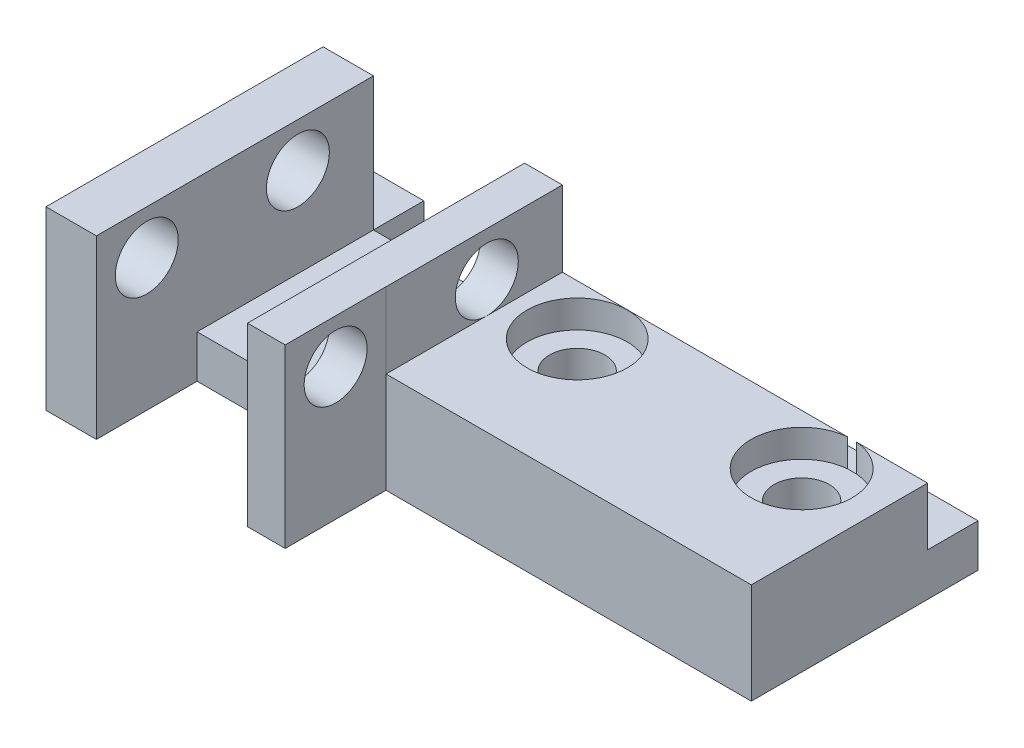
from build123d import *

# Parameters (mm, degrees)
SKETCH1_R           = 0.8
BOSS_EXTRUDE1_DEPTH = 3
SKETCH3_W           = 24
SKETCH3_H           = 4
BOSS_EXTRUDE2_DEPTH = 4
SKETCH6_W           = 24
SKETCH6_H           = 4
BOSS_EXTRUDE4_DEPTH = 3
CUT_EXTRUDE1_DEPTH  = 2.3
SKETCH9_W           = 2
SKETCH9_H           = 7
SKETCH9_W_2         = 1.5
BOSS_EXTRUDE5_DEPTH = 3
SKETCH11_W          = 2
SKETCH11_H          = 7
SKETCH11_W_2        = 1.497470588
BOSS_EXTRUDE6_DEPTH = 4
SKETCH10_R          = 1.25
CUT_EXTRUDE2_DEPTH  = 18.557049866
SKETCH12_W          = 2
SKETCH12_H          = 1.704314434
SKETCH12_W_2        = 16
BOSS_EXTRUDE7_DEPTH = 2
SKETCH13_R          = 1.1
CUT_EXTRUDE3_DEPTH  = 10
SKETCH15_R          = 2.007738278
SKETCH15_R_2        = 1.991162831
CUT_EXTRUDE4_DEPTH  = 1.1


with BuildPart() as part:
    # Sketch1 → Boss-Extrude1 (new body)
    with BuildSketch(Plane(origin=(0, 0, 0), x_dir=(1, 0, 0), z_dir=(0, 1, 0))):
        with Locations((-4, 2)):
            Circle(SKETCH1_R)
    extrude(amount=-BOSS_EXTRUDE1_DEPTH)

    # Sketch3 → Boss-Extrude2 (add)
    with BuildSketch(Plane(origin=(0, 0, 0), x_dir=(1, 0, 0), z_dir=(0, 1, 0))):
        with Locations((-13, 2)):
            Rectangle(SKETCH3_W, SKETCH3_H)
    extrude(amount=BOSS_EXTRUDE2_DEPTH)

    # Sketch6 → Boss-Extrude4 (add)
    with BuildSketch(Plane.XY):
        with Locations((-13, 2)):
            Rectangle(SKETCH6_W, SKETCH6_H)
    extrude(amount=BOSS_EXTRUDE4_DEPTH)

    # Sketch7 → Cut-Extrude1 (cut)
    with BuildSketch(Plane(origin=(0, 4, 0), x_dir=(1, 0, 0), z_dir=(0, 1, 0))):
        Polygon((-23, 0.5), (-23, -3), (-17, -3), (-17, 4), (-23, 4), align=None)
    extrude(amount=-CUT_EXTRUDE1_DEPTH, mode=Mode.SUBTRACT)

    # Sketch9 → Boss-Extrude5 (add)
    with BuildSketch(Plane(origin=(0, 4, 0), x_dir=(1, 0, 0), z_dir=(0, 1, 0))):
        with Locations((-24, 0.5)):
            Rectangle(SKETCH9_W, SKETCH9_H)
        with Locations((-16.25, 0.5)):
            Rectangle(SKETCH9_W_2, SKETCH9_H)
    extrude(amount=BOSS_EXTRUDE5_DEPTH)

    # Sketch11 → Boss-Extrude6 (add)
    with BuildSketch(Plane.XY.offset(3)):
        with Locations((-24, 3.5)):
            Rectangle(SKETCH11_W, SKETCH11_H)
        with Locations((-16.251264706, 3.5)):
            Rectangle(SKETCH11_W_2, SKETCH11_H)
    extrude(amount=BOSS_EXTRUDE6_DEPTH)

    # Sketch10 → Cut-Extrude2 (cut, through all)
    with BuildSketch(Plane(origin=(-15.5, 0, 0), x_dir=(0, 0, -1), z_dir=(1, 0, 0))):
        with Locations((1, 5.25)):
            Circle(SKETCH10_R)
        with Locations((-5, 5.25)):
            Circle(SKETCH10_R)
    extrude(amount=-CUT_EXTRUDE2_DEPTH, mode=Mode.SUBTRACT)

    # Sketch12 → Boss-Extrude7 (add)
    with BuildSketch(Plane(origin=(0, 0, -4), x_dir=(-1, 0, 0), z_dir=(0, 0, -1))):
        with Locations((24, 0.852157217)):
            Rectangle(SKETCH12_W, SKETCH12_H)
        with Locations((9, 0.852157217)):
            Rectangle(SKETCH12_W_2, SKETCH12_H)
    extrude(amount=BOSS_EXTRUDE7_DEPTH)

    # Sketch13 → Cut-Extrude3 (cut)
    with BuildSketch(Plane(origin=(0, 4, 0), x_dir=(1, 0, 0), z_dir=(0, 1, 0))):
        with Locations((-4, 2)):
            Circle(SKETCH13_R)
        with Locations((-12.911847898, 2)):
            Circle(SKETCH13_R)
    extrude(amount=-CUT_EXTRUDE3_DEPTH, mode=Mode.SUBTRACT)

    # Sketch15 → Cut-Extrude4 (cut)
    with BuildSketch(Plane(origin=(0, 4, 0), x_dir=(1, 0, 0), z_dir=(0, 1, 0))):
        with Locations((-4, 2)):
            Circle(SKETCH15_R)
        with Locations((-12.911847898, 2)):
            Circle(SKETCH15_R_2)
    extrude(amount=-CUT_EXTRUDE4_DEPTH, mode=Mode.SUBTRACT)


solid = part.part
